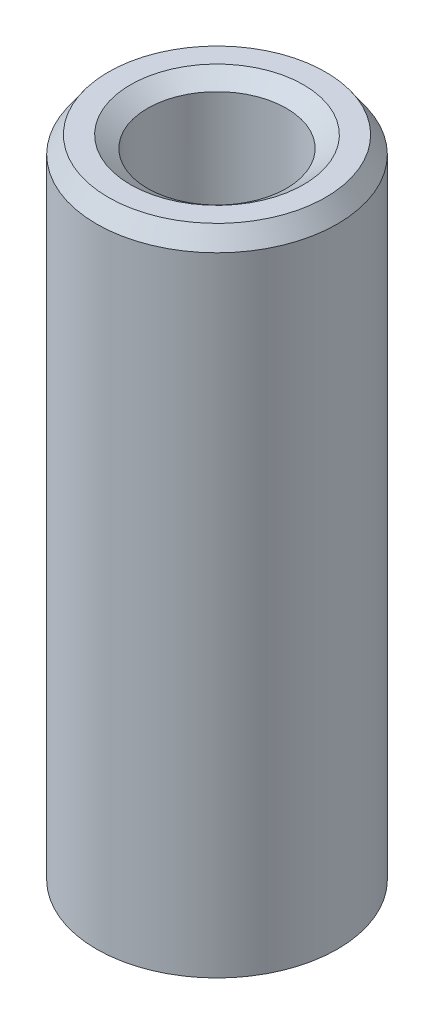
from build123d import *
from OCP.BRepFilletAPI import BRepFilletAPI_MakeChamfer

# Parameters (mm, degrees)
SKETCH1_R           = 22.5
BOSS_EXTRUDE1_DEPTH = 122.712555155
SKETCH2_R           = 12.970140566
CUT_EXTRUDE1_DEPTH  = 127.770939858
CHAMFER1_SIZE       = 3.197545055
CHAMFER1_SIZE2      = 2.208591515


with BuildPart() as part:
    # Sketch1 → Boss-Extrude1 (new body)
    with BuildSketch(Plane(origin=(0, 0, 0), x_dir=(1, 0, 0), z_dir=(0, 1, 0))):
        Circle(SKETCH1_R)
    extrude(amount=BOSS_EXTRUDE1_DEPTH)

    # Sketch2 → Cut-Extrude1 (cut, through all)
    with BuildSketch(Plane(origin=(0, 0, 0), x_dir=(1, 0, 0), z_dir=(0, 1, 0))):
        Circle(SKETCH2_R)
    extrude(amount=CUT_EXTRUDE1_DEPTH, mode=Mode.SUBTRACT)

    # Chamfer1: one chamfer whose edges measure the first distance from different faces: ONE call of the kernel's chamfer builder (chamfer() names one face for all edges)
    chamfer1_edges_1 = [part.edges().sort_by_distance(p)[0] for p in [
        (-12.970140566, 122.712555155, 0),
    ]]
    chamfer1_side_1 = [part.faces().sort_by_distance(p)[0] for p in [
        (-21.863603897, 122.712555155, 0),
    ]]
    chamfer1_edges_2 = [part.edges().sort_by_distance(p)[0] for p in [
        (-12.970140566, 0, 0),
    ]]
    chamfer1_side_2 = [part.faces().sort_by_distance(p)[0] for p in [
        (-12.970140566, 61.356277577, 0),
    ]]
    chamfer1_edges_3 = [part.edges().sort_by_distance(p)[0] for p in [
        (-22.5, 0, 0),
    ]]
    chamfer1_side_3 = [part.faces().sort_by_distance(p)[0] for p in [
        (-21.863603897, 0, 0),
    ]]
    chamfer1_edges_4 = [part.edges().sort_by_distance(p)[0] for p in [
        (-22.5, 122.712555155, 0),
    ]]
    chamfer1_side_4 = [part.faces().sort_by_distance(p)[0] for p in [
        (-22.5, 61.356277577, 0),
    ]]
    chamfer1 = BRepFilletAPI_MakeChamfer(part.part.solid().wrapped)
    for e in chamfer1_edges_1:
        chamfer1.Add(CHAMFER1_SIZE, CHAMFER1_SIZE2, e.wrapped, chamfer1_side_1[0].wrapped)  # the first distance lies on this face
    for e in chamfer1_edges_2:
        chamfer1.Add(CHAMFER1_SIZE, CHAMFER1_SIZE2, e.wrapped, chamfer1_side_2[0].wrapped)  # the first distance lies on this face
    for e in chamfer1_edges_3:
        chamfer1.Add(CHAMFER1_SIZE, CHAMFER1_SIZE2, e.wrapped, chamfer1_side_3[0].wrapped)  # the first distance lies on this face
    for e in chamfer1_edges_4:
        chamfer1.Add(CHAMFER1_SIZE, CHAMFER1_SIZE2, e.wrapped, chamfer1_side_4[0].wrapped)  # the first distance lies on this face
    add(Compound.cast(chamfer1.Shape()), mode=Mode.REPLACE)


solid = part.part
